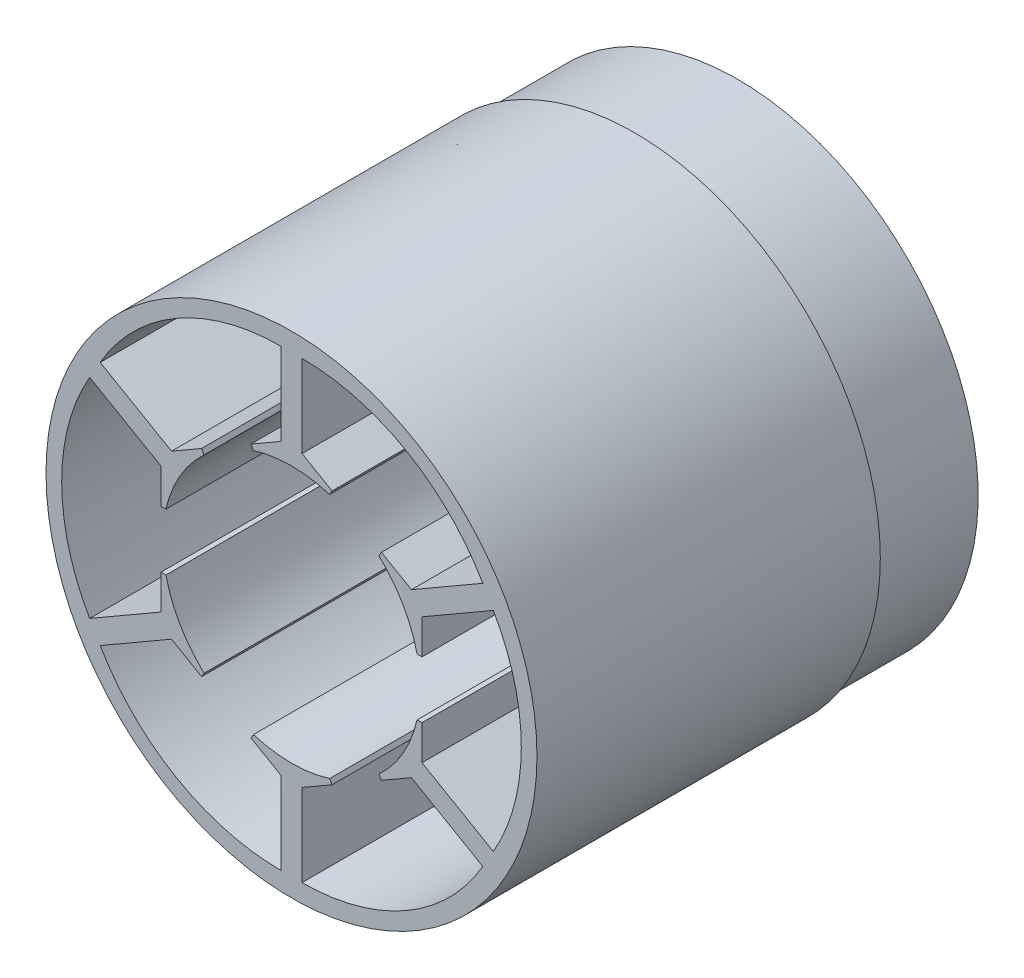
from build123d import *

# Parameters (mm, degrees)
MOTOR_BASE_R                    = 35.75
STATOR_SHELL_DEPTH              = 65
MOTOR_BASE_4_R                  = 18.75
CUT_EXTRUDE1_DEPTH              = 83.347586486
STATOR_LAMINATION_SUPPORT_DEPTH = 16.35
CUT_EXTRUDE3_DEPTH              = 83.347586486
SKETCH7_R                       = 37.5
SKETCH7_R_2                     = 35
BASE_CONNECTION_CUT_DEPTH       = 15


with BuildPart() as part:
    # Motor_Base → Stator_Shell (new body)
    with BuildSketch(Plane.XY):
        Circle(MOTOR_BASE_R)
        with BuildLine():
            Line((1.533091596, 21.069409042), (1.533091596, 33.069409042))
            ThreePointArc((1.533091596, 33.069409042), (16.733091596, 28.996581317), (27.860263871, 17.869409042))
            Line((27.860263871, 17.869409042), (17.467959025, 11.869409042))
            Line((17.467959025, 11.869409042), (1.533091596, 21.069409042))
        make_face(mode=Mode.SUBTRACT)
        with BuildLine():
            Line((-1.533091596, 21.069409042), (-1.533091596, 33.069409042))
            ThreePointArc((-1.533091596, 33.069409042), (-16.733091596, 28.996581317), (-27.860263871, 17.869409042))
            Line((-27.860263871, 17.869409042), (-17.467959025, 11.869409042))
            Line((-17.467959025, 11.869409042), (-1.533091596, 21.069409042))
        make_face(mode=Mode.SUBTRACT)
        with BuildLine():
            Line((19.001050621, 9.214016506), (29.393355467, 15.214016506))
            ThreePointArc((29.393355467, 15.214016506), (33.466183191, 0.014016506), (29.393355467, -15.185983494))
            Line((29.393355467, -15.185983494), (19.001050621, -9.185983494))
            Line((19.001050621, -9.185983494), (19.001050621, 9.214016506))
        make_face(mode=Mode.SUBTRACT)
        with BuildLine():
            Line((17.467959025, -11.841376031), (27.860263871, -17.841376031))
            ThreePointArc((27.860263871, -17.841376031), (16.733091596, -28.968548306), (1.533091596, -33.041376031))
            Line((1.533091596, -33.041376031), (1.533091596, -21.041376031))
            Line((1.533091596, -21.041376031), (17.467959025, -11.841376031))
        make_face(mode=Mode.SUBTRACT)
        with BuildLine():
            Line((-1.533091596, -21.041376031), (-1.533091596, -33.041376031))
            ThreePointArc((-1.533091596, -33.041376031), (-16.733091596, -28.968548306), (-27.860263871, -17.841376031))
            Line((-27.860263871, -17.841376031), (-17.467959025, -11.841376031))
            Line((-17.467959025, -11.841376031), (-1.533091596, -21.041376031))
        make_face(mode=Mode.SUBTRACT)
        with BuildLine():
            Line((-19.001050621, -9.185983494), (-29.393355467, -15.185983494))
            ThreePointArc((-29.393355467, -15.185983494), (-33.466183191, 0.014016506), (-29.393355467, 15.214016506))
            Line((-29.393355467, 15.214016506), (-19.001050621, 9.214016506))
            Line((-19.001050621, 9.214016506), (-19.001050621, -9.185983494))
        make_face(mode=Mode.SUBTRACT)
    extrude(amount=STATOR_SHELL_DEPTH)

    # Motor_Base<4> → Cut-Extrude1 (cut, through all)
    with BuildSketch(Plane.XY):
        Circle(MOTOR_BASE_4_R)
    extrude(amount=CUT_EXTRUDE1_DEPTH, mode=Mode.SUBTRACT)

    # Stator_Lam_Support → Stator Lamination Support (add)
    with BuildSketch(Plane(origin=(0, 0, 0), x_dir=(-1, 0, 0), z_dir=(0, 0, -1))):
        with BuildLine():
            Line((14.351295245, 31.306334292), (13.506552589, 28.096442893))
            Line((13.506552589, 28.096442893), (17.559972866, 25.758191299))
            Line((17.559972866, 25.758191299), (19.915725917, 28.096442893))
            ThreePointArc((19.915725917, 28.096442893), (17.208516366, 29.831413083), (14.351295245, 31.306334292))
        make_face()
        with BuildLine():
            Line((34.287728419, 3.224580887), (31.085509595, 2.351203787))
            Line((31.085509595, 2.351203787), (31.087234454, -2.328286942))
            Line((31.087234454, -2.328286942), (34.29009626, -3.199303133))
            ThreePointArc((34.29009626, -3.199303133), (34.439019743, 0.012694207), (34.287728419, 3.224580887))
        make_face()
        with BuildLine():
            Line((19.936433174, -28.081753405), (17.578957007, -25.745239106))
            Line((17.578957007, -25.745239106), (13.527261587, -28.086478241))
            Line((13.527261587, -28.086478241), (14.374370343, -31.295746025))
            ThreePointArc((14.374370343, -31.295746025), (17.230503377, -29.818718876), (19.936433174, -28.081753405))
        make_face()
        with BuildLine():
            Line((-14.351295245, -31.306334292), (-13.506552589, -28.096442893))
            Line((-13.506552589, -28.096442893), (-17.559972866, -25.758191299))
            Line((-17.559972866, -25.758191299), (-19.915725917, -28.096442893))
            ThreePointArc((-19.915725917, -28.096442893), (-17.208516366, -29.831413083), (-14.351295245, -31.306334292))
        make_face()
        with BuildLine():
            Line((-34.287728419, -3.224580887), (-31.085509595, -2.351203787))
            Line((-31.085509595, -2.351203787), (-31.087234454, 2.328286942))
            Line((-31.087234454, 2.328286942), (-34.29009626, 3.199303133))
            ThreePointArc((-34.29009626, 3.199303133), (-34.439019743, -0.012694207), (-34.287728419, -3.224580887))
        make_face()
        with BuildLine():
            Line((-19.936433174, 28.081753405), (-17.578957007, 25.745239106))
            Line((-17.578957007, 25.745239106), (-13.527261587, 28.086478241))
            Line((-13.527261587, 28.086478241), (-14.374370343, 31.295746025))
            ThreePointArc((-14.374370343, 31.295746025), (-17.230503377, 29.818718876), (-19.936433174, 28.081753405))
        make_face()
    extrude(amount=-STATOR_LAMINATION_SUPPORT_DEPTH)

    # Sketch6 → Cut-Extrude3 (cut, through all)
    with BuildSketch(Plane.XY.offset(65)):
        Polygon((14.405256844, 16.666586459), (11.56399771, 11.741189457), (4.374457659, 15.888539677), (7.215716793, 20.813936679), align=None)
        Polygon((21.633256314, 4.15797429), (21.63631569, -4.142025146), (15.950167195, -4.144121058), (15.947107819, 4.155878379), align=None)
        Polygon((14.417539521, -16.655962389), (7.231058845, -20.808611605), (4.386169485, -15.885310514), (11.57265016, -11.732661299), align=None)
        Polygon((-7.215716793, -20.813936679), (-14.405256844, -16.666586459), (-11.56399771, -11.741189457), (-4.374457659, -15.888539677), align=None)
        Polygon((-21.633256314, -4.15797429), (-21.63631569, 4.142025146), (-15.950167195, 4.144121058), (-15.947107819, -4.155878379), align=None)
        Polygon((-14.417539521, 16.655962389), (-7.231058845, 20.808611605), (-4.386169485, 15.885310514), (-11.57265016, 11.732661299), align=None)
    extrude(amount=-CUT_EXTRUDE3_DEPTH, mode=Mode.SUBTRACT)

    # Sketch7 → Base_Connection_Cut (cut)
    with BuildSketch(Plane(origin=(0, 0, 0), x_dir=(-1, 0, 0), z_dir=(0, 0, -1))):
        Circle(SKETCH7_R)
        Circle(SKETCH7_R_2, mode=Mode.SUBTRACT)
    extrude(amount=-BASE_CONNECTION_CUT_DEPTH, mode=Mode.SUBTRACT)


solid = part.part
